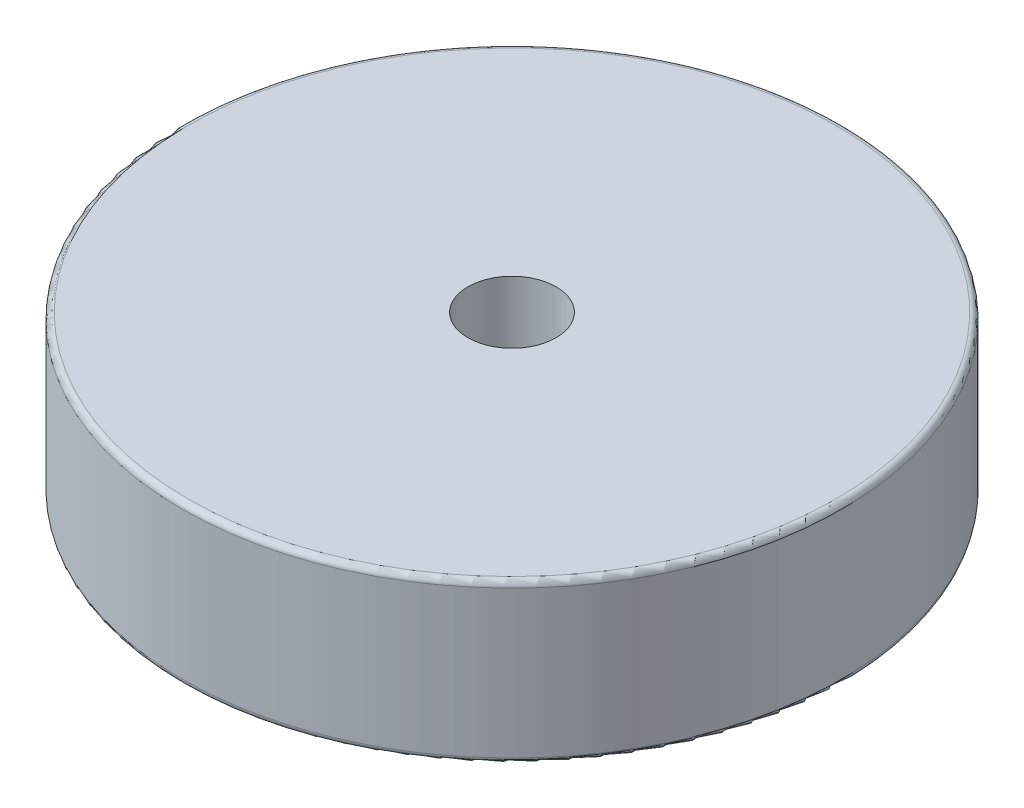
from build123d import *

# Parameters (mm, degrees)
SKETCH_1_R          = 56
EXTRUDE_1_DEPTH     = 27
SKETCH_3_R          = 29.5
EXTRUDE_2_DEPTH     = 5
FILLET_1_R          = 5
SKETCH_6_R          = 7.5
CUT_EXTRUDE_1_DEPTH = 33
FILLET_2_R          = 1
FILLET_3_R          = 1


with BuildPart() as part:
    # Эскиз1 → Бобышка-Вытянуть1 (new body)
    with BuildSketch(Plane(origin=(0, 0, 0), x_dir=(1, 0, 0), z_dir=(0, 1, 0))):
        with Locations(Location((0, 0, 0), (0, 0, 270))):
            Circle(SKETCH_1_R)
    extrude(amount=-EXTRUDE_1_DEPTH)

    # Эскиз3 → Бобышка-Вытянуть2 (add)
    with BuildSketch(Plane(origin=(0, -27, 0), x_dir=(-1, 0, 0), z_dir=(0, -1, 0))):
        with Locations(Location((0, 0, 0), (0, 0, 270))):
            Circle(SKETCH_3_R)
    extrude(amount=EXTRUDE_2_DEPTH)

    # Скругление1
    fillet_1_edges = [part.edges().sort_by_distance(p)[0] for p in [
        (0, -32, -29.5),
    ]]
    fillet(fillet_1_edges, radius=FILLET_1_R - 0.0001)  # a hair under: the kernel refuses the full size

    # Эскиз6 → Вырез-Вытянуть1 (cut)
    with BuildSketch(Plane.XZ.offset(32)):
        with Locations(Location((0, 0, 0), (0, 0, 270))):
            Circle(SKETCH_6_R)
    extrude(amount=-CUT_EXTRUDE_1_DEPTH, mode=Mode.SUBTRACT)

    # Скругление2
    fillet_2_edges = [part.edges().sort_by_distance(p)[0] for p in [
        (0, -32, 7.5),
    ]]
    fillet(fillet_2_edges, radius=FILLET_2_R)

    # Скругление3
    fillet_3_edges = [part.edges().sort_by_distance(p)[0] for p in [
        (0, 0, -56),
        (0, -27, -56),
    ]]
    fillet(fillet_3_edges, radius=FILLET_3_R)


solid = part.part
